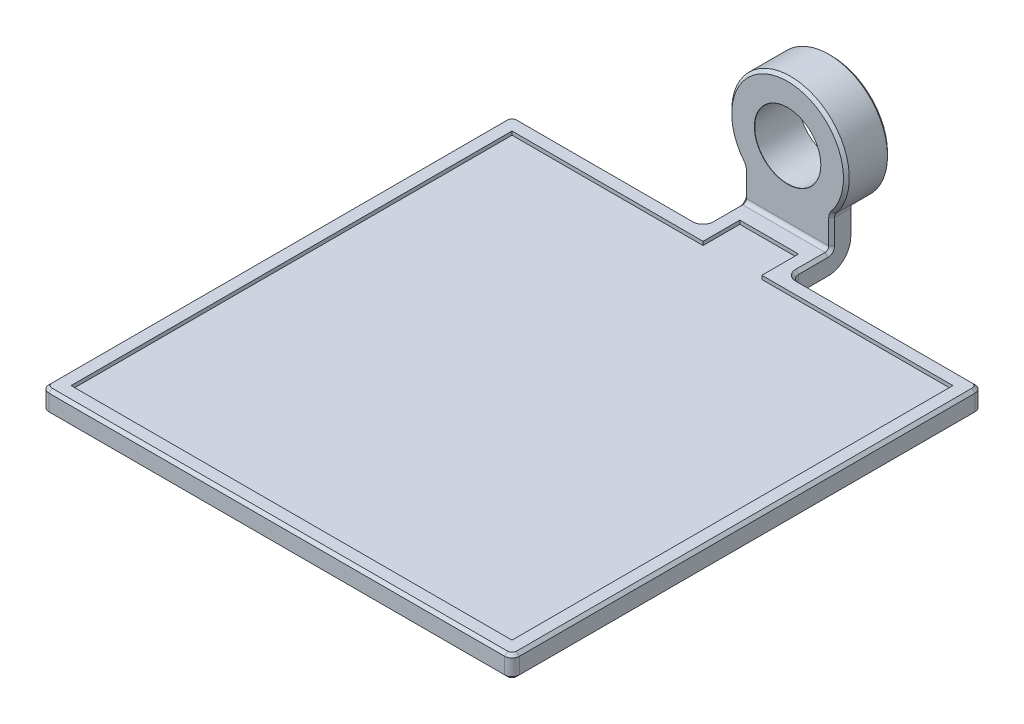
from build123d import *

# Parameters (mm, degrees)
SKETCH1_R                      = 8
BOSS_EXTRUDE1_DEPTH            = 6
BOSS_EXTRUDE2_DEPTH            = 6
SKETCH5_W                      = 64
SKETCH5_H                      = 64
BOSS_EXTRUDE3_DEPTH            = 3
CUT_EXTRUDE1_DEPTH             = 0.5
FILLET2_R                      = 1
M8_CLEARANCE_HOLE1_D           = 9
M8_CLEARANCE_HOLE1_CSINK_D     = 9.05
M8_CLEARANCE_HOLE1_CSINK_ANGLE = 90
CHAMFER1_SIZE                  = 0.4


with BuildPart() as part:
    # Sketch1 → Boss-Extrude1 (new body)
    with BuildSketch(Plane.XY):
        Circle(SKETCH1_R)
    extrude(amount=BOSS_EXTRUDE1_DEPTH)

    # Sketch4 → Boss-Extrude2 (add, symmetric)
    with BuildSketch(Plane(origin=(0, 0, 0), x_dir=(0, 0, -1), z_dir=(1, 0, 0))):
        with BuildLine():
            Line((-6, -4.5), (-6, -9))
            ThreePointArc((-6, -9), (-6.146446609, -9.353553391), (-6.5, -9.5))
            Line((-6.5, -9.5), (-11.5, -9.5))
            Line((-11.5, -9.5), (-11.5, -12.5))
            Line((-11.5, -12.5), (-6.5, -12.5))
            ThreePointArc((-6.5, -12.5), (-4.025126266, -11.474873734), (-3, -9))
            Line((-3, -9), (-3, -4.5))
            Line((-3, -4.5), (-6, -4.5))
        make_face()
    extrude(amount=BOSS_EXTRUDE2_DEPTH, both=True)

    # Sketch5 → Boss-Extrude3 (add)
    with BuildSketch(Plane(origin=(0, -9.5, 0), x_dir=(1, 0, 0), z_dir=(0, 1, 0))):
        with Locations((0, -43.5)):
            Rectangle(SKETCH5_W, SKETCH5_H)
    extrude(amount=-BOSS_EXTRUDE3_DEPTH)

    # Sketch6 → Cut-Extrude1 (cut)
    with BuildSketch(Plane(origin=(0, -9.5, 0), x_dir=(1, 0, 0), z_dir=(0, 1, 0))):
        Polygon((-4, -8.5), (-4, -13.5), (-30, -13.5), (-30, -73.5), (30, -73.5), (30, -13.5), (4, -13.5), (4, -8.5), align=None)
    extrude(amount=-CUT_EXTRUDE1_DEPTH, mode=Mode.SUBTRACT)

    # Fillet2
    fillet2_edges = [part.edges().sort_by_distance(p)[0] for p in [
        (6, -11, 11.5),
        (-6, -11, 11.5),
        (-6, -5.291502622, 4.5),
        (32, -11, 11.5),
        (32, -11, 75.5),
        (-32, -11, 75.5),
        (-32, -11, 11.5),
        (6, -5.291502622, 4.5),
    ]]
    fillet(fillet2_edges, radius=FILLET2_R)

    # M8 Clearance Hole1 (through all)
    with Locations(Plane.XY.offset(6)):
        with Locations((0, 0)):
            CounterSinkHole(M8_CLEARANCE_HOLE1_D / 2, M8_CLEARANCE_HOLE1_CSINK_D / 2, counter_sink_angle=M8_CLEARANCE_HOLE1_CSINK_ANGLE)

    # Chamfer1
    # the kernel refuses this chamfer: 0.4 mm, written as the material it takes off along each edge
    with BuildSketch(Plane(origin=(6, -9.5, 6.5), x_dir=(0.027495876610587302, -0.9996219169112966, 0), z_dir=(0, 0, 1)), Plane(origin=(-6, -12.5, 10.5), x_dir=(0.9996219169112966, -0.027495876610587302, 0), z_dir=(0, 0, -1))) as chamfer1_piece_1:
        Polygon((CHAMFER1_SIZE * 0.999621916911, -CHAMFER1_SIZE * 0.0274958766106), (-CHAMFER1_SIZE * 0.0274958766106, -CHAMFER1_SIZE * 0.999621916911), (0, 0), align=None)
    extrude(amount=4, mode=Mode.SUBTRACT)
    with BuildSketch(Plane(origin=(6, -9, 6.5), x_dir=(0, -1, 0), z_dir=(0, 0, 1))) as chamfer1_piece_2:
        Polygon((3.5, -CHAMFER1_SIZE), (3.5 - CHAMFER1_SIZE, 0), (3.5, 0), align=None)
    revolve(axis=Axis((6, -9, 6.5), (1, 0, 0)), revolution_arc=90, mode=Mode.SUBTRACT)
    with BuildSketch(Plane(origin=(-6, -9, 6.5), x_dir=(0, 0, -1), z_dir=(0, 1, 0))) as chamfer1_piece_3:
        Polygon((0.5 + CHAMFER1_SIZE, 0), (0.5, -CHAMFER1_SIZE), (0.5, 0), align=None)
    revolve(axis=Axis((-6, -9, 6.5), (-1, 0, 0)), revolution_arc=90, mode=Mode.SUBTRACT)
    with BuildSketch(Plane(origin=(-6, -9.5, 6.5), x_dir=(-0.027495876610587302, -0.9996219169112966, 0), z_dir=(0, 0, 1)), Plane(origin=(6, -12.5, 10.5), x_dir=(-0.9996219169112966, -0.027495876610587302, 0), z_dir=(0, 0, -1))) as chamfer1_piece_4:
        Polygon((CHAMFER1_SIZE * 0.999621916911, CHAMFER1_SIZE * 0.0274958766106), (-CHAMFER1_SIZE * 0.0274958766106, CHAMFER1_SIZE * 0.999621916911), (0, 0), align=None)
    extrude(amount=4, mode=Mode.SUBTRACT)
    with BuildSketch(Plane(origin=(-6, -9, 6.5), x_dir=(0, -1, 0), z_dir=(0, 0, 1))) as chamfer1_piece_5:
        Polygon((3.5 - CHAMFER1_SIZE, 0), (3.5, CHAMFER1_SIZE), (3.5, 0), align=None)
    revolve(axis=Axis((-6, -9, 6.5), (1, 0, 0)), revolution_arc=90, mode=Mode.SUBTRACT)
    with BuildSketch(Plane(origin=(-6, -9, 3), x_dir=(-0.02749587661058736, 0, 0.9996219169112966), z_dir=(0, 1, 0))) as chamfer1_piece_6_section:
        Polygon((CHAMFER1_SIZE * 0.999621916911, CHAMFER1_SIZE * 0.0274958766106), (-CHAMFER1_SIZE * 0.0274958766106, CHAMFER1_SIZE * 0.999621916911), (0, 0), align=None)
    chamfer1_piece_6 = extrude(amount=3.343145751, mode=Mode.PRIVATE)
    chamfer1_piece_6 = chamfer1_piece_6 - Plane(origin=(0, 0, 3.170790462), x_dir=(1, 0, 0), z_dir=(0, 0, -1)) * Cylinder(8, 9, mode=Mode.PRIVATE)
    add(chamfer1_piece_6, mode=Mode.SUBTRACT)
    with BuildSketch(Plane(origin=(0, 0, 0), x_dir=(1, 0, 0), z_dir=(0, -1, 0))) as chamfer1_piece_7:
        Polygon((8 - CHAMFER1_SIZE, 0), (8, CHAMFER1_SIZE), (8, 0), align=None)
    revolve(axis=Axis((0, 0, 0), (0, 0, 1)), mode=Mode.SUBTRACT)
    with BuildSketch(Plane(origin=(0, 0, 6), x_dir=(1, 0, 0), z_dir=(0, -1, 0))) as chamfer1_piece_8:
        Polygon((8 - CHAMFER1_SIZE, 0), (8, -CHAMFER1_SIZE), (8, 0), align=None)
    revolve(axis=Axis((0, 0, 6), (0, 0, 1)), revolution_arc=218.942441269, mode=Mode.SUBTRACT)
    with BuildSketch(Plane(origin=(-6, -5.656854249, 6), x_dir=(-0.027495876610587302, 0, -0.9996219169112966), z_dir=(0, -1, 0)), Plane(origin=(6, -5.656854249, 6), x_dir=(-0.9996219169112966, 0, 0.027495876610587302), z_dir=(0, -1, 0))) as chamfer1_piece_9:
        Polygon((CHAMFER1_SIZE * 0.999621916911, CHAMFER1_SIZE * 0.0274958766106), (-CHAMFER1_SIZE * 0.0274958766106, CHAMFER1_SIZE * 0.999621916911), (0, 0), align=None)
    extrude(amount=3.343145751, mode=Mode.SUBTRACT)
    with BuildSketch(Plane(origin=(31, -9.5, 11.5), x_dir=(0, -0.9996219169112966, -0.027495876610587302), z_dir=(-1, 0, 0)), Plane(origin=(-7, -9.5, 11.5), x_dir=(0, -0.9996219169112966, -0.027495876610587302), z_dir=(-1, 0, 0)), Plane(origin=(-7, -12.5, 11.5), x_dir=(0, -0.027495876610587302, 0.9996219169112966), z_dir=(-1, 0, 0))) as chamfer1_piece_10:
        Polygon((CHAMFER1_SIZE * 0.999621916911, CHAMFER1_SIZE * 0.0274958766106), (-CHAMFER1_SIZE * 0.0274958766106, CHAMFER1_SIZE * 0.999621916911), (0, 0), align=None)
    extrude(amount=24, mode=Mode.SUBTRACT)
    with BuildSketch(Plane(origin=(31, -12.5, 11.5), x_dir=(0, 0.9996219169112966, -0.027495876610587302), z_dir=(-1, 0, 0))) as chamfer1_piece_11:
        Polygon((CHAMFER1_SIZE * 0.999621916911, -CHAMFER1_SIZE * 0.0274958766106), (-CHAMFER1_SIZE * 0.0274958766106, -CHAMFER1_SIZE * 0.999621916911), (0, 0), align=None)
    extrude(amount=24, mode=Mode.SUBTRACT)
    with BuildSketch(Plane(origin=(32, -12.5, 74.5), x_dir=(-0.9996219169112966, -0.02749587661058742, 0), z_dir=(0, 0, -1)), Plane(origin=(32, -9.5, 74.5), x_dir=(0.027495876610578673, -0.999621916911297, 0), z_dir=(0, 0, -1)), Plane(origin=(-32, -9.5, 12.5), x_dir=(-0.027495876610578673, -0.999621916911297, 0), z_dir=(0, 0, 1)), Plane(origin=(-31, -9.5, 75.5), x_dir=(0, -0.9996219169112964, 0.027495876610595927), z_dir=(1, 0, 0)), Plane(origin=(-31, -12.5, 75.5), x_dir=(0, -0.02749587661058671, -0.9996219169112966), z_dir=(1, 0, 0)), Plane(origin=(-32, -12.5, 12.5), x_dir=(0.9996219169112966, -0.02749587661058742, 0), z_dir=(0, 0, 1))) as chamfer1_piece_12:
        Polygon((CHAMFER1_SIZE * 0.999621916911, CHAMFER1_SIZE * 0.0274958766106), (-CHAMFER1_SIZE * 0.0274958766106, CHAMFER1_SIZE * 0.999621916911), (0, 0), align=None)
    extrude(amount=62, mode=Mode.SUBTRACT)
    with BuildSketch(Plane(origin=(-31, -9.5, 12.5), x_dir=(-1, 0, 0), z_dir=(0, 0, 1))) as chamfer1_piece_13:
        Polygon((1, CHAMFER1_SIZE), (1 - CHAMFER1_SIZE, 0), (1, 0), align=None)
    revolve(axis=Axis((-31, -9.5, 12.5), (0, -1, 0)), revolution_arc=90, mode=Mode.SUBTRACT)
    with BuildSketch(Plane(origin=(-31, -9.5, 74.5), x_dir=(0, 0, 1), z_dir=(1, 0, 0))) as chamfer1_piece_14:
        Polygon((1, CHAMFER1_SIZE), (1 - CHAMFER1_SIZE, 0), (1, 0), align=None)
    revolve(axis=Axis((-31, -9.5, 74.5), (0, -1, 0)), revolution_arc=90, mode=Mode.SUBTRACT)
    with BuildSketch(Plane(origin=(31, -9.5, 74.5), x_dir=(1, 0, 0), z_dir=(0, 0, -1))) as chamfer1_piece_15:
        Polygon((1, CHAMFER1_SIZE), (1 - CHAMFER1_SIZE, 0), (1, 0), align=None)
    revolve(axis=Axis((31, -9.5, 74.5), (0, -1, 0)), revolution_arc=90, mode=Mode.SUBTRACT)
    with BuildSketch(Plane(origin=(31, -9.5, 12.5), x_dir=(0, 0, -1), z_dir=(-1, 0, 0))) as chamfer1_piece_16:
        Polygon((1, CHAMFER1_SIZE), (1 - CHAMFER1_SIZE, 0), (1, 0), align=None)
    revolve(axis=Axis((31, -9.5, 12.5), (0, -1, 0)), revolution_arc=90, mode=Mode.SUBTRACT)
    with BuildSketch(Plane(origin=(-31, -12.5, 12.5), x_dir=(-1, 0, 0), z_dir=(0, 0, 1))) as chamfer1_piece_17:
        Polygon((1 - CHAMFER1_SIZE, 0), (1, -CHAMFER1_SIZE), (1, 0), align=None)
    revolve(axis=Axis((-31, -12.5, 12.5), (0, -1, 0)), revolution_arc=90, mode=Mode.SUBTRACT)
    with BuildSketch(Plane(origin=(-31, -12.5, 74.5), x_dir=(0, 0, 1), z_dir=(1, 0, 0))) as chamfer1_piece_18:
        Polygon((1 - CHAMFER1_SIZE, 0), (1, -CHAMFER1_SIZE), (1, 0), align=None)
    revolve(axis=Axis((-31, -12.5, 74.5), (0, -1, 0)), revolution_arc=90, mode=Mode.SUBTRACT)
    with BuildSketch(Plane(origin=(31, -12.5, 74.5), x_dir=(1, 0, 0), z_dir=(0, 0, -1))) as chamfer1_piece_19:
        Polygon((1 - CHAMFER1_SIZE, 0), (1, -CHAMFER1_SIZE), (1, 0), align=None)
    revolve(axis=Axis((31, -12.5, 74.5), (0, -1, 0)), revolution_arc=90, mode=Mode.SUBTRACT)
    with BuildSketch(Plane(origin=(6, -9, 3), x_dir=(-0.9996219169112968, 0, -0.027495876610586226), z_dir=(0, 1, 0))) as chamfer1_piece_20_section:
        Polygon((CHAMFER1_SIZE * 0.999621916911, CHAMFER1_SIZE * 0.0274958766106), (-CHAMFER1_SIZE * 0.0274958766106, CHAMFER1_SIZE * 0.999621916911), (0, 0), align=None)
    chamfer1_piece_20 = extrude(amount=3.343145751, mode=Mode.PRIVATE)
    chamfer1_piece_20 = chamfer1_piece_20 - Plane(origin=(0, 0, 3.119938156), x_dir=(1, 0, 0), z_dir=(0, 0, -1)) * Cylinder(8, 9, mode=Mode.PRIVATE)
    add(chamfer1_piece_20, mode=Mode.SUBTRACT)
    with BuildSketch(Plane(origin=(31, -12.5, 12.5), x_dir=(0, 0, -1), z_dir=(-1, 0, 0))) as chamfer1_piece_21:
        Polygon((1 - CHAMFER1_SIZE, 0), (1, -CHAMFER1_SIZE), (1, 0), align=None)
    revolve(axis=Axis((31, -12.5, 12.5), (0, -1, 0)), revolution_arc=90, mode=Mode.SUBTRACT)
    with BuildSketch(Plane(origin=(-7, -5.656854249, 6), x_dir=(1, 0, 0), z_dir=(0, -1, 0))) as chamfer1_piece_22:
        Polygon((1 + CHAMFER1_SIZE, 0), (1, -CHAMFER1_SIZE), (1, 0), align=None)
    revolve(axis=Axis((-7, -5.656854249, 6), (0, 0, 1)), revolution_arc=38.942441269, mode=Mode.SUBTRACT)
    with BuildSketch(Plane(origin=(-7, -5.656854249, 3), x_dir=(1, 0, 0), z_dir=(0, -1, 0))) as chamfer1_piece_23_section:
        Polygon((1, CHAMFER1_SIZE), (1 + CHAMFER1_SIZE, 0), (1, 0), align=None)
    chamfer1_piece_23 = revolve(axis=Axis((-7, -5.656854249, 3), (0, 0, 1)), revolution_arc=97.885505576, mode=Mode.PRIVATE)
    chamfer1_piece_23 = chamfer1_piece_23 - Plane(origin=(0, 0, 3.19057738), x_dir=(1, 0, 0), z_dir=(0, 0, -1)) * Cylinder(8, 6, mode=Mode.PRIVATE)
    add(chamfer1_piece_23, mode=Mode.SUBTRACT)
    with BuildSketch(Plane(origin=(7, -5.656854249, 6), x_dir=(-1, 0, 0), z_dir=(0, -1, 0))) as chamfer1_piece_24:
        Polygon((1 + CHAMFER1_SIZE, 0), (1, CHAMFER1_SIZE), (1, 0), align=None)
    revolve(axis=Axis((7, -5.656854249, 6), (0, 0, -1)), revolution_arc=38.942441269, mode=Mode.SUBTRACT)
    with BuildSketch(Plane(origin=(7, -5.656854249, 3), x_dir=(-1, 0, 0), z_dir=(0, -1, 0))) as chamfer1_piece_25_section:
        Polygon((1, -CHAMFER1_SIZE), (1 + CHAMFER1_SIZE, 0), (1, 0), align=None)
    chamfer1_piece_25 = revolve(axis=Axis((7, -5.656854249, 3), (0, 0, -1)), revolution_arc=97.885505576, mode=Mode.PRIVATE)
    chamfer1_piece_25 = chamfer1_piece_25 - Plane(origin=(0, 0, 3.190577372), x_dir=(1, 0, 0), z_dir=(0, 0, -1)) * Cylinder(8, 6, mode=Mode.PRIVATE)
    add(chamfer1_piece_25, mode=Mode.SUBTRACT)
    with BuildSketch(Plane(origin=(7, -12.5, 10.5), x_dir=(0, 0, 1), z_dir=(1, 0, 0))) as chamfer1_piece_26:
        Polygon((1 + CHAMFER1_SIZE, 0), (1, -CHAMFER1_SIZE), (1, 0), align=None)
    revolve(axis=Axis((7, -12.5, 10.5), (0, -1, 0)), revolution_arc=90, mode=Mode.SUBTRACT)
    with BuildSketch(Plane(origin=(7, -9.5, 10.5), x_dir=(0, 0, 1), z_dir=(1, 0, 0))) as chamfer1_piece_27:
        Polygon((1, CHAMFER1_SIZE), (1 + CHAMFER1_SIZE, 0), (1, 0), align=None)
    revolve(axis=Axis((7, -9.5, 10.5), (0, -1, 0)), revolution_arc=90, mode=Mode.SUBTRACT)
    with BuildSketch(Plane(origin=(-7, -12.5, 10.5), x_dir=(1, 0, 0), z_dir=(0, 0, -1))) as chamfer1_piece_28:
        Polygon((1 + CHAMFER1_SIZE, 0), (1, -CHAMFER1_SIZE), (1, 0), align=None)
    revolve(axis=Axis((-7, -12.5, 10.5), (0, -1, 0)), revolution_arc=90, mode=Mode.SUBTRACT)
    with BuildSketch(Plane(origin=(6, -9, 6.5), x_dir=(0, 0, -1), z_dir=(0, 1, 0))) as chamfer1_piece_29:
        Polygon((0.5, CHAMFER1_SIZE), (0.5 + CHAMFER1_SIZE, 0), (0.5, 0), align=None)
    revolve(axis=Axis((6, -9, 6.5), (-1, 0, 0)), revolution_arc=90, mode=Mode.SUBTRACT)
    with BuildSketch(Plane(origin=(-7, -9.5, 10.5), x_dir=(1, 0, 0), z_dir=(0, 0, -1))) as chamfer1_piece_30:
        Polygon((1, CHAMFER1_SIZE), (1 + CHAMFER1_SIZE, 0), (1, 0), align=None)
    revolve(axis=Axis((-7, -9.5, 10.5), (0, -1, 0)), revolution_arc=90, mode=Mode.SUBTRACT)
    with BuildSketch(Plane(origin=(0, 0, 6), x_dir=(0.7777777777777778, -0.628539361054709, 0), z_dir=(-0.628539361054709, -0.7777777777777778, 0))) as chamfer1_piece_31:
        Polygon((8 - CHAMFER1_SIZE, 0), (8, -CHAMFER1_SIZE), (8, 0), align=None)
    revolve(axis=Axis((0, 0, 6), (0, 0, 1)), revolution_arc=38.942441269, mode=Mode.SUBTRACT)


solid = part.part
